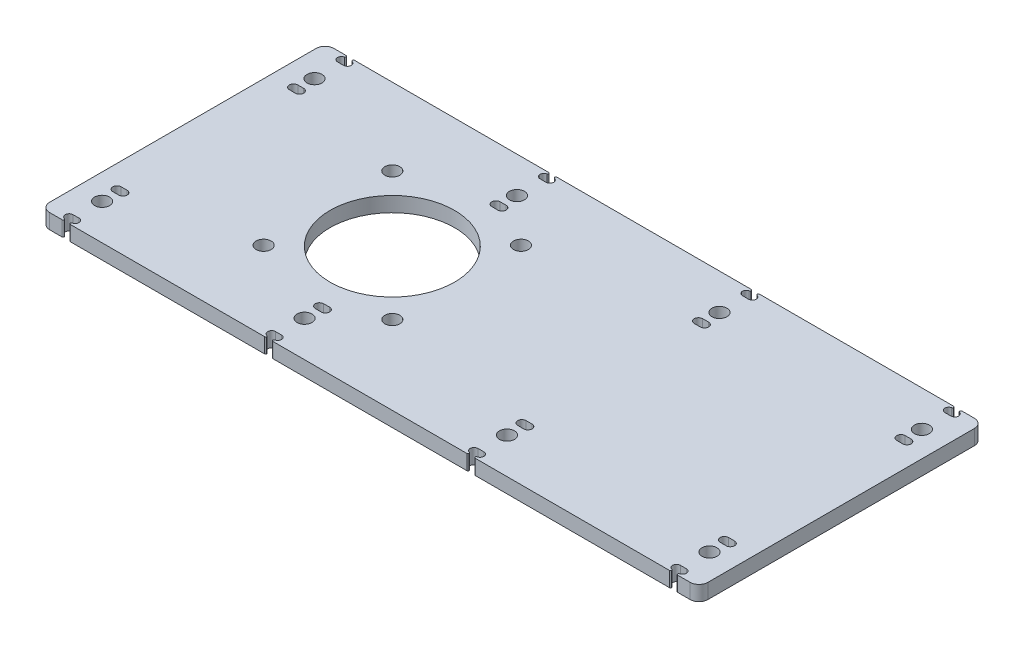
from build123d import *

# Parameters (mm, degrees)
SKETCH1_R           = 20.8
BOSS_EXTRUDE1_DEPTH = 5
SKETCH2_R           = 2.5
CUT_EXTRUDE1_DEPTH  = 381.250527306
SKETCH5_R           = 2.5
CUT_EXTRUDE5_DEPTH  = 209.206628137
FILLET1_R           = 0.4
FILLET2_R           = 3


with BuildPart() as part:
    # Sketch1 → Boss-Extrude1 (new body)
    with BuildSketch(Plane(origin=(0, 0, 0), x_dir=(1, 0, 0), z_dir=(0, 1, 0))):
        Polygon((0, -10), (190, -10), (190, 85), (0, 85), (-30, 85), (-30, -10), align=None)
        with Locations(Location((40, 37.5, 0), (0, 0, 270))):
            Circle(SKETCH1_R, mode=Mode.SUBTRACT)
    extrude(amount=BOSS_EXTRUDE1_DEPTH)

    # Sketch2 → Cut-Extrude1 (cut, through all)
    with BuildSketch(Plane(origin=(-147.27442804, 0, -165.531831037), x_dir=(1, 0, 0), z_dir=(0, -1, 0))):
        with Locations(Location((208.487631475, 149.245034473, 0), (0, 0, 270))):
            Circle(SKETCH2_R)
        with Locations(Location((208.487631475, 106.245034473, 0), (0, 0, 270))):
            Circle(SKETCH2_R)
        with Locations(Location((165.487631475, 149.245034473, 0), (0, 0, 270))):
            Circle(SKETCH2_R)
        with Locations(Location((165.487631475, 106.245034473, 0), (0, 0, 270))):
            Circle(SKETCH2_R)
    extrude(amount=-CUT_EXTRUDE1_DEPTH, mode=Mode.SUBTRACT)

    # Sketch5 → Cut-Extrude5 (cut, through all)
    with BuildSketch(Plane(origin=(0, 0, 0), x_dir=(-1, 0, 0), z_dir=(0, -1, 0))):
        with Locations(Location((21.499999973, 73, 0), (0, 0, 90))):
            Circle(SKETCH5_R)
        with Locations(Location((-46.160000027, 73, 0), (0, 0, 90))):
            Circle(SKETCH5_R)
        with Locations(Location((-113.820000027, 73, 0), (0, 0, 90))):
            Circle(SKETCH5_R)
        with Locations(Location((-181.480000027, 73, 0), (0, 0, 90))):
            Circle(SKETCH5_R)
        with Locations(Location((-181.480000027, 2, 0), (0, 0, 270))):
            Circle(SKETCH5_R)
        with Locations(Location((-113.820000027, 2, 0), (0, 0, 270))):
            Circle(SKETCH5_R)
        with Locations(Location((-46.160000027, 2, 0), (0, 0, 270))):
            Circle(SKETCH5_R)
        with Locations(Location((21.499999973, 2, 0), (0, 0, 270))):
            Circle(SKETCH5_R)
        with BuildLine():
            Line((20.499999973, 68.4), (22.499999973, 68.4))
            ThreePointArc((22.499999973, 68.4), (23.899999973, 67), (22.499999973, 65.6))
            Line((22.499999973, 65.6), (20.499999973, 65.6))
            ThreePointArc((20.499999973, 65.6), (19.099999973, 67), (20.499999973, 68.4))
        make_face()
        with BuildLine():
            Line((20.499999973, 81.7), (22.499999973, 81.7))
            ThreePointArc((22.499999973, 81.7), (23.799999973, 83), (22.499999973, 84.3))
            Line((22.499999973, 84.3), (22.499999973, 85))
            Line((22.499999973, 85), (20.499999973, 85))
            Line((20.499999973, 85), (20.499999973, 84.3))
            ThreePointArc((20.499999973, 84.3), (19.199999973, 83), (20.499999973, 81.7))
        make_face()
        with BuildLine():
            Line((-47.160000027, 68.4), (-45.160000027, 68.4))
            ThreePointArc((-45.160000027, 68.4), (-43.760000027, 67), (-45.160000027, 65.6))
            Line((-45.160000027, 65.6), (-47.160000027, 65.6))
            ThreePointArc((-47.160000027, 65.6), (-48.560000027, 67), (-47.160000027, 68.4))
        make_face()
        with BuildLine():
            Line((-47.160000027, 81.7), (-45.160000027, 81.7))
            ThreePointArc((-45.160000027, 81.7), (-43.860000027, 83), (-45.160000027, 84.3))
            Line((-45.160000027, 84.3), (-45.160000027, 85))
            Line((-45.160000027, 85), (-47.160000027, 85))
            Line((-47.160000027, 85), (-47.160000027, 84.3))
            ThreePointArc((-47.160000027, 84.3), (-48.460000027, 83), (-47.160000027, 81.7))
        make_face()
        with BuildLine():
            Line((-114.820000027, 68.4), (-112.820000027, 68.4))
            ThreePointArc((-112.820000027, 68.4), (-111.420000027, 67), (-112.820000027, 65.6))
            Line((-112.820000027, 65.6), (-114.820000027, 65.6))
            ThreePointArc((-114.820000027, 65.6), (-116.220000027, 67), (-114.820000027, 68.4))
        make_face()
        with BuildLine():
            Line((-114.820000027, 81.7), (-112.820000027, 81.7))
            ThreePointArc((-112.820000027, 81.7), (-111.520000027, 83), (-112.820000027, 84.3))
            Line((-112.820000027, 84.3), (-112.820000027, 85))
            Line((-112.820000027, 85), (-114.820000027, 85))
            Line((-114.820000027, 85), (-114.820000027, 84.3))
            ThreePointArc((-114.820000027, 84.3), (-116.120000027, 83), (-114.820000027, 81.7))
        make_face()
        with BuildLine():
            Line((-182.480000027, 68.4), (-180.480000027, 68.4))
            ThreePointArc((-180.480000027, 68.4), (-179.080000027, 67), (-180.480000027, 65.6))
            Line((-180.480000027, 65.6), (-182.480000027, 65.6))
            ThreePointArc((-182.480000027, 65.6), (-183.880000027, 67), (-182.480000027, 68.4))
        make_face()
        with BuildLine():
            Line((-182.480000027, 81.7), (-180.480000027, 81.7))
            ThreePointArc((-180.480000027, 81.7), (-179.180000027, 83), (-180.480000027, 84.3))
            Line((-180.480000027, 84.3), (-180.480000027, 85))
            Line((-180.480000027, 85), (-182.480000027, 85))
            Line((-182.480000027, 85), (-182.480000027, 84.3))
            ThreePointArc((-182.480000027, 84.3), (-183.780000027, 83), (-182.480000027, 81.7))
        make_face()
        with BuildLine():
            Line((-180.480000027, -10), (-182.480000027, -10))
            Line((-182.480000027, -10), (-182.480000027, -9.3))
            ThreePointArc((-182.480000027, -9.3), (-183.780000027, -8), (-182.480000027, -6.7))
            Line((-182.480000027, -6.7), (-180.480000027, -6.7))
            ThreePointArc((-180.480000027, -6.7), (-179.180000027, -8), (-180.480000027, -9.3))
            Line((-180.480000027, -9.3), (-180.480000027, -10))
        make_face()
        with BuildLine():
            Line((-112.820000027, -10), (-114.820000027, -10))
            Line((-114.820000027, -10), (-114.820000027, -9.3))
            ThreePointArc((-114.820000027, -9.3), (-116.120000027, -8), (-114.820000027, -6.7))
            Line((-114.820000027, -6.7), (-112.820000027, -6.7))
            ThreePointArc((-112.820000027, -6.7), (-111.520000027, -8), (-112.820000027, -9.3))
            Line((-112.820000027, -9.3), (-112.820000027, -10))
        make_face()
        with BuildLine():
            Line((-45.160000027, -10), (-47.160000027, -10))
            Line((-47.160000027, -10), (-47.160000027, -9.3))
            ThreePointArc((-47.160000027, -9.3), (-48.460000027, -8), (-47.160000027, -6.7))
            Line((-47.160000027, -6.7), (-45.160000027, -6.7))
            ThreePointArc((-45.160000027, -6.7), (-43.860000027, -8), (-45.160000027, -9.3))
            Line((-45.160000027, -9.3), (-45.160000027, -10))
        make_face()
        with BuildLine():
            Line((22.499999973, -10), (20.499999973, -10))
            Line((20.499999973, -10), (20.499999973, -9.3))
            ThreePointArc((20.499999973, -9.3), (19.199999973, -8), (20.499999973, -6.7))
            Line((20.499999973, -6.7), (22.499999973, -6.7))
            ThreePointArc((22.499999973, -6.7), (23.799999973, -8), (22.499999973, -9.3))
            Line((22.499999973, -9.3), (22.499999973, -10))
        make_face()
        with BuildLine():
            Line((-182.480000027, 6.6), (-180.480000027, 6.6))
            ThreePointArc((-180.480000027, 6.6), (-179.080000027, 8), (-180.480000027, 9.4))
            Line((-180.480000027, 9.4), (-182.480000027, 9.4))
            ThreePointArc((-182.480000027, 9.4), (-183.880000027, 8), (-182.480000027, 6.6))
        make_face()
        with BuildLine():
            Line((-114.820000027, 6.6), (-112.820000027, 6.6))
            ThreePointArc((-112.820000027, 6.6), (-111.420000027, 8), (-112.820000027, 9.4))
            Line((-112.820000027, 9.4), (-114.820000027, 9.4))
            ThreePointArc((-114.820000027, 9.4), (-116.220000027, 8), (-114.820000027, 6.6))
        make_face()
        with BuildLine():
            Line((-47.160000027, 6.6), (-45.160000027, 6.6))
            ThreePointArc((-45.160000027, 6.6), (-43.760000027, 8), (-45.160000027, 9.4))
            Line((-45.160000027, 9.4), (-47.160000027, 9.4))
            ThreePointArc((-47.160000027, 9.4), (-48.560000027, 8), (-47.160000027, 6.6))
        make_face()
        with BuildLine():
            Line((20.499999973, 6.6), (22.499999973, 6.6))
            ThreePointArc((22.499999973, 6.6), (23.899999973, 8), (22.499999973, 9.4))
            Line((22.499999973, 9.4), (20.499999973, 9.4))
            ThreePointArc((20.499999973, 9.4), (19.099999973, 8), (20.499999973, 6.6))
        make_face()
    extrude(amount=-CUT_EXTRUDE5_DEPTH, mode=Mode.SUBTRACT)

    # Fillet1
    # the kernel refuses this fillet: 0.4 mm, written as the material it takes off along each edge
    with BuildSketch(Plane(origin=(180.480000027, -0.88067791, 9.3), x_dir=(-0.9929562463235445, 0, -0.11848161413087033), z_dir=(0, 1, 0)), Plane(origin=(182.480000027, -0.88067791, -84.3), x_dir=(0.9929562463240562, 0, 0.11848161412658191), z_dir=(0, 1, 0)), Plane(origin=(45.160000027, -0.88067791, 9.3), x_dir=(-0.9929562463237254, 0, -0.11848161412935371), z_dir=(0, 1, 0)), Plane(origin=(112.820000027, -0.88067791, 9.3), x_dir=(-0.9929562463236348, 0, -0.11848161413011311), z_dir=(0, 1, 0)), Plane(origin=(-20.499999973, -0.88067791, -84.3), x_dir=(0.9929562463238144, 0, 0.11848161412860814), z_dir=(0, 1, 0)), Plane(origin=(47.160000027, -0.88067791, -84.3), x_dir=(0.9929562463238953, 0, 0.11848161412793001), z_dir=(0, 1, 0)), Plane(origin=(114.820000027, -0.88067791, -84.3), x_dir=(0.9929562463239765, 0, 0.11848161412724918), z_dir=(0, 1, 0)), Plane(origin=(-22.499999973, -0.88067791, 9.3), x_dir=(-0.9929562463238167, 0, -0.11848161412858836), z_dir=(0, 1, 0))) as fillet1_piece_1:
        with BuildLine():
            CenterArc((0.355444842, 0.397182499), FILLET1_R, 186.804480316, 76.391039369)
            Line((-0.041737656, 0.349789853), (0, 0))
            ThreePointArc((0, 0), (0.154026098, 0.00915688), (0.308052197, 0))
        make_face()
    extrude(amount=6.761355821, mode=Mode.SUBTRACT)
    with BuildSketch(Plane(origin=(180.480000027, -1, 10), x_dir=(0, 0, -1), z_dir=(0, 1, 0)), Plane(origin=(182.480000027, -1, 10), x_dir=(1, 0, 0), z_dir=(0, 1, 0)), Plane(origin=(180.480000027, -1, -85), x_dir=(-1, 0, 0), z_dir=(0, 1, 0)), Plane(origin=(45.160000027, -1, 10), x_dir=(0, 0, -1), z_dir=(0, 1, 0)), Plane(origin=(47.160000027, -1, 10), x_dir=(1, 0, 0), z_dir=(0, 1, 0)), Plane(origin=(112.820000027, -1, 10), x_dir=(0, 0, -1), z_dir=(0, 1, 0)), Plane(origin=(114.820000027, -1, 10), x_dir=(1, 0, 0), z_dir=(0, 1, 0)), Plane(origin=(-20.499999973, -1, -85), x_dir=(0, 0, 1), z_dir=(0, 1, 0)), Plane(origin=(-22.499999973, -1, -85), x_dir=(-1, 0, 0), z_dir=(0, 1, 0)), Plane(origin=(47.160000027, -1, -85), x_dir=(0, 0, 1), z_dir=(0, 1, 0)), Plane(origin=(45.160000027, -1, -85), x_dir=(-1, 0, 0), z_dir=(0, 1, 0)), Plane(origin=(114.820000027, -1, -85), x_dir=(0, 0, 1), z_dir=(0, 1, 0)), Plane(origin=(112.820000027, -1, -85), x_dir=(-1, 0, 0), z_dir=(0, 1, 0)), Plane(origin=(-22.499999973, -1, 10), x_dir=(0, 0, -1), z_dir=(0, 1, 0)), Plane(origin=(-20.499999973, -1, 10), x_dir=(1, 0, 0), z_dir=(0, 1, 0))) as fillet1_piece_2:
        with BuildLine():
            CenterArc((FILLET1_R, FILLET1_R), FILLET1_R, 180, 90)
            Line((0, FILLET1_R), (0, 0))
            Line((0, 0), (FILLET1_R, 0))
        make_face()
    extrude(amount=7, mode=Mode.SUBTRACT)
    with BuildSketch(Plane(origin=(182.480000027, -0.88067791, 9.3), x_dir=(0, 0, 1), z_dir=(0, 1, 0)), Plane(origin=(180.480000027, -0.88067791, -84.3), x_dir=(0, 0, -1), z_dir=(0, 1, 0)), Plane(origin=(47.160000027, -0.88067791, 9.3), x_dir=(0, 0, 1), z_dir=(0, 1, 0)), Plane(origin=(114.820000027, -0.88067791, 9.3), x_dir=(0, 0, 1), z_dir=(0, 1, 0)), Plane(origin=(-22.499999973, -0.88067791, -84.3), x_dir=(0, 0, -1), z_dir=(0, 1, 0)), Plane(origin=(45.160000027, -0.88067791, -84.3), x_dir=(0, 0, -1), z_dir=(0, 1, 0)), Plane(origin=(112.820000027, -0.88067791, -84.3), x_dir=(0, 0, -1), z_dir=(0, 1, 0)), Plane(origin=(-20.499999973, -0.88067791, 9.3), x_dir=(0, 0, 1), z_dir=(0, 1, 0))) as fillet1_piece_3:
        with BuildLine():
            CenterArc((0.352271164, 0.4), FILLET1_R, 193.608960631, 76.391039369)
            ThreePointArc((-0.036498522, 0.305882353), (-0.00915688, 0.154026098), (0, 0))
            Line((0, 0), (0.352271164, 0))
        make_face()
    extrude(amount=6.761355821, mode=Mode.SUBTRACT)
    with BuildSketch(Plane(origin=(182.480000027, -1, -85), x_dir=(1, 0, 0), z_dir=(0, 1, 0))) as fillet1_piece_4:
        with BuildLine():
            CenterArc((FILLET1_R, -FILLET1_R), FILLET1_R, 90, 90)
            Line((0, -FILLET1_R), (0, 0))
            Line((0, 0), (FILLET1_R, 0))
        make_face()
    extrude(amount=7, mode=Mode.SUBTRACT)

    # Fillet2
    fillet2_edges = [part.edges().sort_by_distance(p)[0] for p in [
        (-30, 2.5, -85),
        (190, 2.5, -85),
        (190, 2.5, 10),
        (-30, 2.5, 10),
    ]]
    fillet(fillet2_edges, radius=FILLET2_R)


solid = part.part
